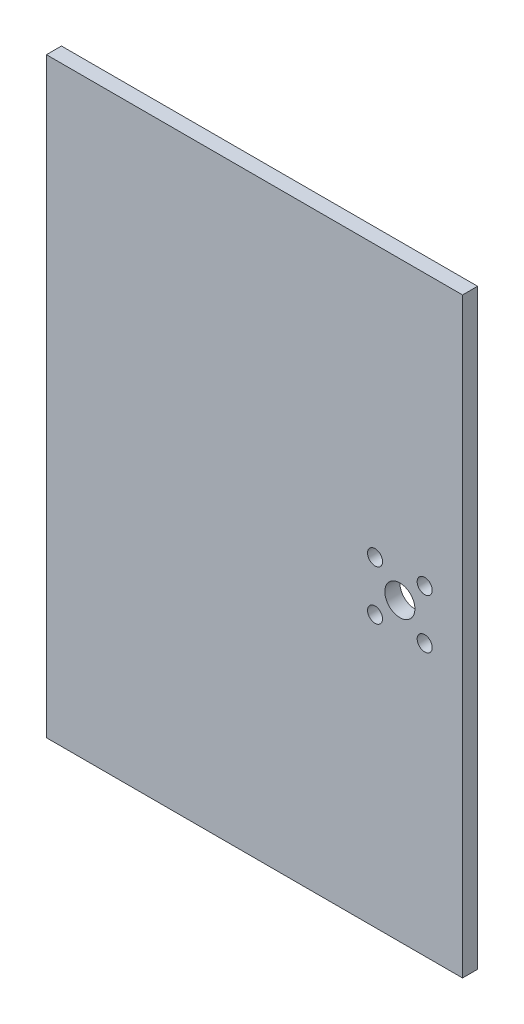
from build123d import *

# Parameters (mm, degrees)
SKETCH_1_W          = 83
SKETCH_1_H          = 118
EXTRUDE_1_DEPTH     = 3
SKETCH_2_R          = 1.5
SKETCH_2_R_2        = 3
CUT_EXTRUDE_1_DEPTH = 3


with BuildPart() as part:
    # 草图1 → 凸台-拉伸1 (new body)
    with BuildSketch(Plane.XY):
        Rectangle(SKETCH_1_W, SKETCH_1_H)
    extrude(amount=EXTRUDE_1_DEPTH)

    # 草图2 → 切除-拉伸1 (cut)
    with BuildSketch(Plane(origin=(0, 0, 0), x_dir=(-1, 0, 0), z_dir=(0, 0, -1))):
        with Locations((-33.949747468, 4.949747468)):
            Circle(SKETCH_2_R)
        with Locations((-24.050252532, 4.949747468)):
            Circle(SKETCH_2_R)
        with Locations((-29, 0)):
            Circle(SKETCH_2_R_2)
        with Locations((-33.949747468, -4.949747468)):
            Circle(SKETCH_2_R)
        with Locations((-24.050252532, -4.949747468)):
            Circle(SKETCH_2_R)
    extrude(amount=-CUT_EXTRUDE_1_DEPTH, mode=Mode.SUBTRACT)


solid = part.part
